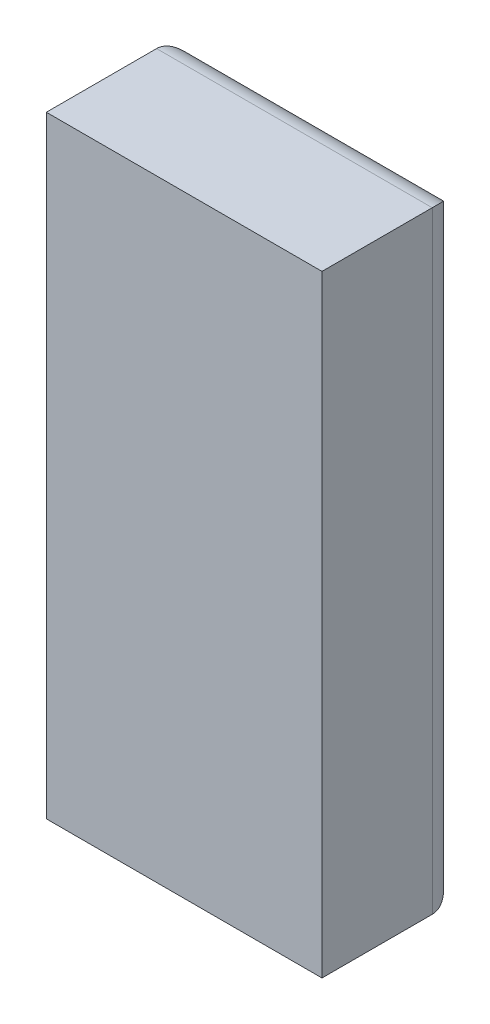
from build123d import *

# Parameters (mm, degrees)
PROFILE_W             = 100
PROFILE_H             = 222
PROFILE_EXTRUDE_DEPTH = 50
FILLET1_R             = 10


with BuildPart() as part:
    # Profile → Profile Extrude (new body)
    with BuildSketch(Plane.XY):
        Rectangle(PROFILE_W, PROFILE_H)
    extrude(amount=-PROFILE_EXTRUDE_DEPTH)

    # Fillet1
    fillet1_edges = [part.edges().sort_by_distance(p)[0] for p in [
        (0, 111, -50),
        (-50, 0, -50),
        (0, -111, -50),
        (50, 0, -50),
    ]]
    fillet(fillet1_edges, radius=FILLET1_R)


solid = part.part
